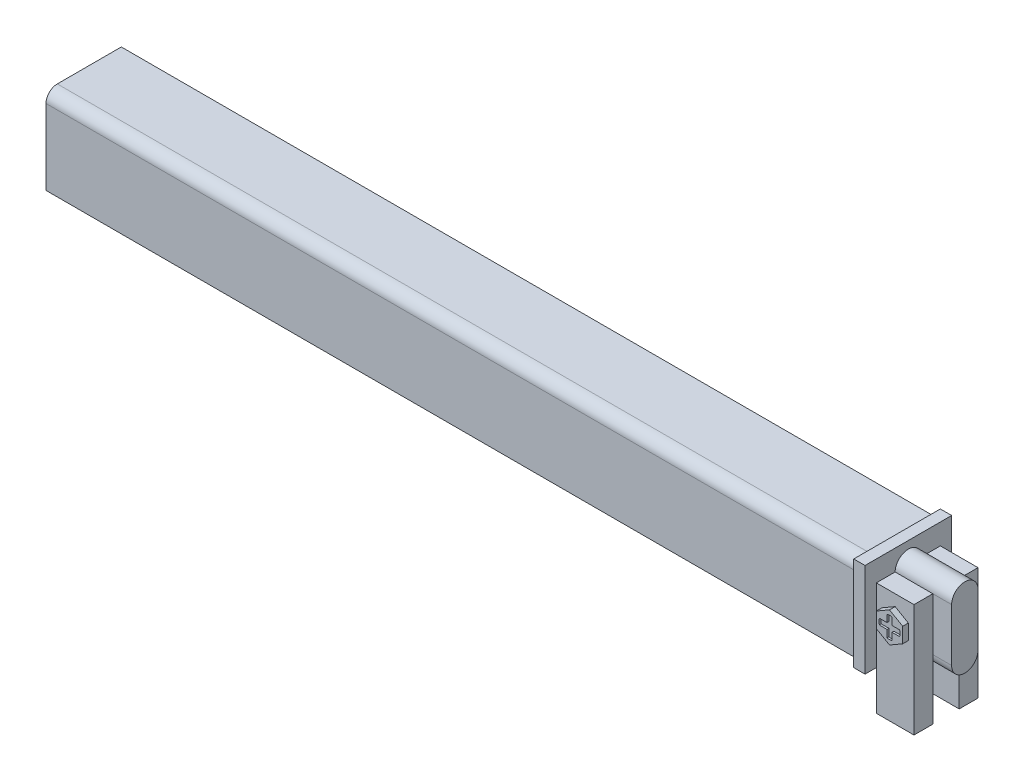
from build123d import *

# Parameters (mm, degrees)
BOSS_EXTRUDE1_DEPTH = 105
SKETCH3_W           = 23
SKETCH3_H           = 25
BOSS_EXTRUDE2_DEPTH = 3
BOSS_EXTRUDE3_DEPTH = 15
SKETCH5_W           = 10
SKETCH5_H           = 30
BOSS_EXTRUDE4_DEPTH = 5
SKETCH6_W           = 10
SKETCH6_H           = 30
BOSS_EXTRUDE5_DEPTH = 5
BOSS_EXTRUDE6_DEPTH = 1.5
BOSS_EXTRUDE7_DEPTH = 1.5
CUT_EXTRUDE2_DEPTH  = 0.5
BOSS_EXTRUDE9_DEPTH = 114


with BuildPart() as part:
    # Sketch2 → Boss-Extrude1 (new body)
    with BuildSketch(Plane(origin=(0, 0, 0), x_dir=(0, 0, -1), z_dir=(1, 0, 0))):
        with BuildLine():
            Line((-7, 11.5), (10, 11.5))
            Line((10, 11.5), (10, -11.5))
            Line((10, -11.5), (-10, -11.5))
            Line((-10, -11.5), (-10, 8.5))
            ThreePointArc((-10, 8.5), (-9.121320344, 10.621320344), (-7, 11.5))
        make_face()
    extrude(amount=BOSS_EXTRUDE1_DEPTH)

    # Sketch3 → Boss-Extrude2 (add)
    with BuildSketch(Plane(origin=(105, 0, 0), x_dir=(0, 0, -1), z_dir=(1, 0, 0))):
        Rectangle(SKETCH3_W, SKETCH3_H)
    extrude(amount=-BOSS_EXTRUDE2_DEPTH)

    # Sketch4 → Boss-Extrude3 (add)
    with BuildSketch(Plane(origin=(105, 0, 0), x_dir=(0, 0, -1), z_dir=(1, 0, 0))):
        with BuildLine():
            Line((3.5, 7), (3.5, -7))
            ThreePointArc((3.5, -7), (0, -10.5), (-3.5, -7))
            Line((-3.5, -7), (-3.5, 7))
            ThreePointArc((-3.5, 7), (0, 10.5), (3.5, 7))
        make_face()
    extrude(amount=BOSS_EXTRUDE3_DEPTH)

    # Sketch6 → Boss-Extrude5 (add)
    with BuildSketch(Plane(origin=(0, 0, -3.5), x_dir=(-1, 0, 0), z_dir=(0, 0, -1))):
        with Locations((-110, -8)):
            Rectangle(SKETCH6_W, SKETCH6_H)
    extrude(amount=BOSS_EXTRUDE5_DEPTH)

    # Sketch7 → Boss-Extrude6 (add)
    with BuildSketch(Plane(origin=(0, 0, -8.5), x_dir=(-1, 0, 0), z_dir=(0, 0, -1))):
        Polygon((-106.5, 2.020725942), (-110, 4.041451884), (-113.5, 2.020725942), (-113.5, -2.020725942), (-110, -4.041451884), (-106.5, -2.020725942), align=None)
    extrude(amount=BOSS_EXTRUDE6_DEPTH)


with BuildPart() as body_2:
    # Sketch5 → Boss-Extrude4 (new body)
    with BuildSketch(Plane.XY.offset(3.5)):
        with Locations((110, -8)):
            Rectangle(SKETCH5_W, SKETCH5_H)
    extrude(amount=BOSS_EXTRUDE4_DEPTH)


    add(part.part)  # Boss-Extrude7 merges part
    # Sketch8 → Boss-Extrude7 (add)
    with BuildSketch(Plane.XY.offset(8.5)):
        Polygon((113.5, 2.020725942), (110, 4.041451884), (106.5, 2.020725942), (106.5, -2.020725942), (110, -4.041451884), (113.5, -2.020725942), align=None)
    extrude(amount=BOSS_EXTRUDE7_DEPTH)

    # Sketch9 → Cut-Extrude2 (cut)
    with BuildSketch(Plane.XY.offset(10)):
        with BuildLine():
            Line((110.665003442, -2.720360037), (110.665003442, -0.784999464))
            Line((110.665003442, -0.784999464), (112.68965723, -0.784999464))
            ThreePointArc((112.68965723, -0.784999464), (112.801948942, 0), (112.68965723, 0.784999464))
            Line((112.68965723, 0.784999464), (110.665003442, 0.784999464))
            Line((110.665003442, 0.784999464), (110.665003442, 2.720360037))
            ThreePointArc((110.665003442, 2.720360037), (110.001948942, 2.8), (109.338894442, 2.720360037))
            Line((109.338894442, 2.720360037), (109.338894442, 0.784999464))
            Line((109.338894442, 0.784999464), (107.314240654, 0.784999464))
            ThreePointArc((107.314240654, 0.784999464), (107.201948942, 0), (107.314240654, -0.784999464))
            Line((107.314240654, -0.784999464), (109.338894442, -0.784999464))
            Line((109.338894442, -0.784999464), (109.338894442, -2.720360037))
            ThreePointArc((109.338894442, -2.720360037), (110.001948942, -2.8), (110.665003442, -2.720360037))
        make_face()
    extrude(amount=-CUT_EXTRUDE2_DEPTH, mode=Mode.SUBTRACT)

    # Sketch12 → Boss-Extrude9 (add)
    with BuildSketch(Plane.ZY):
        with BuildLine():
            Line((7, 11.5), (-10, 11.5))
            Line((-10, 11.5), (-10, -11.5))
            Line((-10, -11.5), (10, -11.5))
            Line((10, -11.5), (10, 8.5))
            ThreePointArc((10, 8.5), (9.121320344, 10.621320344), (7, 11.5))
        make_face()
    extrude(amount=BOSS_EXTRUDE9_DEPTH)


solid = body_2.part
